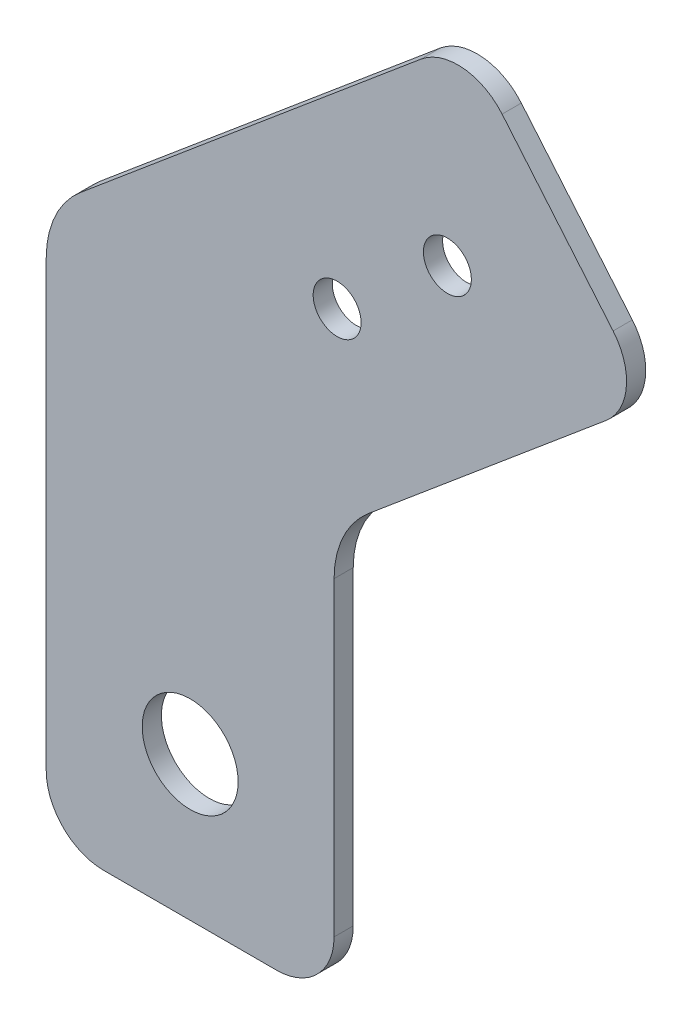
from build123d import *

# Parameters (mm, degrees)
SKETCH1_R          = 5
SKETCH1_R_2        = 2.5
BASE_FLANGE1_DEPTH = 2


# Sheet-metal steps are written as plain solids
with BuildPart() as part:
    # Sketch1 → Base-Flange1 (new body)
    with BuildSketch(Plane.XY):
        with BuildLine():
            Line((-14.238080804, 7.633940989), (-49.730098253, -22.147397762))
            ThreePointArc((-49.730098253, -22.147397762), (-52.365300026, -25.581659576), (-53.302222156, -29.807842194))
            Line((-53.302222156, -29.807842194), (-53.302222156, -48.56164166))
            Line((-53.302222156, -48.56164166), (-53.302222156, -76.139380484))
            ThreePointArc((-53.302222156, -76.139380484), (-51.544862843, -80.382021171), (-47.302222156, -82.139380484))
            Line((-47.302222156, -82.139380484), (-29.302222156, -82.139380484))
            ThreePointArc((-29.302222156, -82.139380484), (-25.059581469, -80.382021171), (-23.302222156, -76.139380484))
            Line((-23.302222156, -76.139380484), (-23.302222156, -48.56164166))
            Line((-23.302222156, -48.56164166), (-23.302222156, -43.797071938))
            ThreePointArc((-23.302222156, -43.797071938), (-22.365300026, -39.570889321), (-19.730098253, -36.136627507))
            Line((-19.730098253, -36.136627507), (5.045547487, -15.347392305))
            ThreePointArc((5.045547487, -15.347392305), (7.165990017, -11.274060103), (5.785088487, -6.894399988))
            Line((5.785088487, -6.894399988), (-5.785088487, 6.894399988))
            ThreePointArc((-5.785088487, 6.894399988), (-9.858420689, 9.014842519), (-14.238080804, 7.633940989))
        make_face()
        with Locations((-38.302222156, -67.139380484)):
            Circle(SKETCH1_R, mode=Mode.SUBTRACT)
        with Locations((-11.490666647, -9.641814145)):
            Circle(SKETCH1_R_2, mode=Mode.SUBTRACT)
        with Locations((-22.981333294, -19.283628291)):
            Circle(SKETCH1_R_2, mode=Mode.SUBTRACT)
    extrude(amount=-BASE_FLANGE1_DEPTH)


solid = part.part
